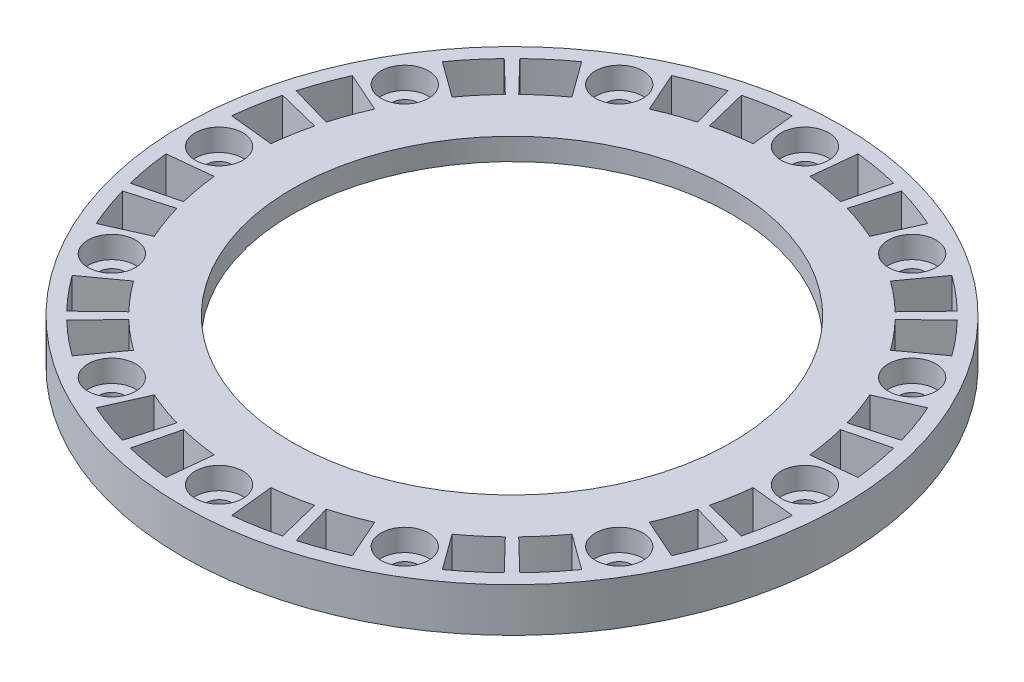
from build123d import *

# Parameters (mm, degrees)
SKETCH1_R           = 45
SKETCH1_R_2         = 30
SKETCH1_R_3         = 1.75
BOSS_EXTRUDE1_DEPTH = 6
SKETCH2_R           = 35.5
CUT_EXTRUDE1_DEPTH  = 3
SKETCH3_R           = 3.25
CUT_EXTRUDE2_DEPTH  = 3
CUT_EXTRUDE3_DEPTH  = 64.921827258


with BuildPart() as part:
    # Sketch1 → Boss-Extrude1 (new body)
    with BuildSketch(Plane(origin=(0, 0, 0), x_dir=(1, 0, 0), z_dir=(0, 1, 0))):
        Circle(SKETCH1_R)
        Circle(SKETCH1_R_2, mode=Mode.SUBTRACT)
        with Locations((0, 40)):
            Circle(SKETCH1_R_3, mode=Mode.SUBTRACT)
        with Locations((20, 34.641016151)):
            Circle(SKETCH1_R_3, mode=Mode.SUBTRACT)
        with Locations((34.641016151, 20)):
            Circle(SKETCH1_R_3, mode=Mode.SUBTRACT)
        with Locations((40, 0)):
            Circle(SKETCH1_R_3, mode=Mode.SUBTRACT)
        with Locations((34.641016151, -20)):
            Circle(SKETCH1_R_3, mode=Mode.SUBTRACT)
        with Locations((20, -34.641016151)):
            Circle(SKETCH1_R_3, mode=Mode.SUBTRACT)
        with Locations((0, -40)):
            Circle(SKETCH1_R_3, mode=Mode.SUBTRACT)
        with Locations((-20, -34.641016151)):
            Circle(SKETCH1_R_3, mode=Mode.SUBTRACT)
        with Locations((-34.641016151, -20)):
            Circle(SKETCH1_R_3, mode=Mode.SUBTRACT)
        with Locations((-40, 0)):
            Circle(SKETCH1_R_3, mode=Mode.SUBTRACT)
        with Locations((-34.641016151, 20)):
            Circle(SKETCH1_R_3, mode=Mode.SUBTRACT)
        with Locations((-20, 34.641016151)):
            Circle(SKETCH1_R_3, mode=Mode.SUBTRACT)
    extrude(amount=BOSS_EXTRUDE1_DEPTH)

    # Sketch2 → Cut-Extrude1 (cut)
    with BuildSketch(Plane.XZ):
        Circle(SKETCH2_R)
    extrude(amount=-CUT_EXTRUDE1_DEPTH, mode=Mode.SUBTRACT)

    # Sketch3 → Cut-Extrude2 (cut)
    with BuildSketch(Plane(origin=(0, 6, 0), x_dir=(1, 0, 0), z_dir=(0, 1, 0))):
        with Locations((40, 0)):
            Circle(SKETCH3_R)
        with Locations((34.641016151, -20)):
            Circle(SKETCH3_R)
        with Locations((20, -34.641016151)):
            Circle(SKETCH3_R)
        with Locations((0, -40)):
            Circle(SKETCH3_R)
        with Locations((-20, -34.641016151)):
            Circle(SKETCH3_R)
        with Locations((-34.641016151, -20)):
            Circle(SKETCH3_R)
        with Locations((-40, 0)):
            Circle(SKETCH3_R)
        with Locations((-34.641016151, 20)):
            Circle(SKETCH3_R)
        with Locations((-20, 34.641016151)):
            Circle(SKETCH3_R)
        with Locations((0, 40)):
            Circle(SKETCH3_R)
        with Locations((20, 34.641016151)):
            Circle(SKETCH3_R)
        with Locations((34.641016151, 20)):
            Circle(SKETCH3_R)
    extrude(amount=-CUT_EXTRUDE2_DEPTH, mode=Mode.SUBTRACT)

    # Sketch4 → Cut-Extrude3 (cut, through all)
    with BuildSketch(Plane.XZ):
        with BuildLine():
            Line((42.764441501, -4.494723921), (36.797310129, -3.867553141))
            ThreePointArc((36.797310129, -3.867553141), (36.437886861, -6.424982574), (35.900941872, -8.951110137))
            Line((35.900941872, -8.951110137), (41.72271623, -10.402641511))
            ThreePointArc((41.72271623, -10.402641511), (42.34673338, -7.46687164), (42.764441501, -4.494723921))
        make_face()
        with BuildLine():
            Line((39.282454679, -17.489675652), (33.801181933, -15.049255794))
            ThreePointArc((33.801181933, -15.049255794), (34.768626969, -12.654745303), (35.56668275, -10.198582165))
            Line((35.56668275, -10.198582165), (41.334252925, -11.8524063))
            ThreePointArc((41.334252925, -11.8524063), (40.406782694, -14.706866163), (39.282454679, -17.489675652))
        make_face()
        with BuildLine():
            Line((34.787730758, -25.274765849), (29.933628792, -21.748054335))
            ThreePointArc((29.933628792, -21.748054335), (28.343644395, -23.783141558), (26.615572613, -25.702359707))
            Line((26.615572613, -25.702359707), (30.931611415, -29.87030993))
            ThreePointArc((30.931611415, -29.87030993), (32.939911054, -27.639867217), (34.787730758, -25.274765849))
        make_face()
        with BuildLine():
            Line((29.87030993, -30.931611415), (25.702359707, -26.615572613))
            ThreePointArc((25.702359707, -26.615572613), (23.783141558, -28.343644395), (21.748054335, -29.933628792))
            Line((21.748054335, -29.933628792), (25.274765849, -34.787730758))
            ThreePointArc((25.274765849, -34.787730758), (27.639867217, -32.939911054), (29.87030993, -30.931611415))
        make_face()
        with BuildLine():
            Line((17.489675652, -39.282454679), (15.049255794, -33.801181933))
            ThreePointArc((15.049255794, -33.801181933), (12.654745303, -34.768626969), (10.198582165, -35.56668275))
            Line((10.198582165, -35.56668275), (11.8524063, -41.334252925))
            ThreePointArc((11.8524063, -41.334252925), (14.706866163, -40.406782694), (17.489675652, -39.282454679))
        make_face()
        with BuildLine():
            Line((10.402641511, -41.72271623), (8.951110137, -35.900941872))
            ThreePointArc((8.951110137, -35.900941872), (6.424982574, -36.437886861), (3.867553141, -36.797310129))
            Line((3.867553141, -36.797310129), (4.494723921, -42.764441501))
            ThreePointArc((4.494723921, -42.764441501), (7.46687164, -42.34673338), (10.402641511, -41.72271623))
        make_face()
        with BuildLine():
            Line((-4.494723921, -42.764441501), (-3.867553141, -36.797310129))
            ThreePointArc((-3.867553141, -36.797310129), (-6.424982574, -36.437886861), (-8.951110137, -35.900941872))
            Line((-8.951110137, -35.900941872), (-10.402641511, -41.72271623))
            ThreePointArc((-10.402641511, -41.72271623), (-7.46687164, -42.34673338), (-4.494723921, -42.764441501))
        make_face()
        with BuildLine():
            Line((-11.8524063, -41.334252925), (-10.198582165, -35.56668275))
            ThreePointArc((-10.198582165, -35.56668275), (-12.654745303, -34.768626969), (-15.049255794, -33.801181933))
            Line((-15.049255794, -33.801181933), (-17.489675652, -39.282454679))
            ThreePointArc((-17.489675652, -39.282454679), (-14.706866163, -40.406782694), (-11.8524063, -41.334252925))
        make_face()
        with BuildLine():
            Line((-25.274765849, -34.787730758), (-21.748054335, -29.933628792))
            ThreePointArc((-21.748054335, -29.933628792), (-23.783141558, -28.343644395), (-25.702359707, -26.615572613))
            Line((-25.702359707, -26.615572613), (-29.87030993, -30.931611415))
            ThreePointArc((-29.87030993, -30.931611415), (-27.639867217, -32.939911054), (-25.274765849, -34.787730758))
        make_face()
        with BuildLine():
            Line((-30.931611415, -29.87030993), (-26.615572613, -25.702359707))
            ThreePointArc((-26.615572613, -25.702359707), (-28.343644395, -23.783141558), (-29.933628792, -21.748054335))
            Line((-29.933628792, -21.748054335), (-34.787730758, -25.274765849))
            ThreePointArc((-34.787730758, -25.274765849), (-32.939911054, -27.639867217), (-30.931611415, -29.87030993))
        make_face()
        with BuildLine():
            Line((-39.282454679, -17.489675652), (-33.801181933, -15.049255794))
            ThreePointArc((-33.801181933, -15.049255794), (-34.768626969, -12.654745303), (-35.56668275, -10.198582165))
            Line((-35.56668275, -10.198582165), (-41.334252925, -11.8524063))
            ThreePointArc((-41.334252925, -11.8524063), (-40.406782694, -14.706866163), (-39.282454679, -17.489675652))
        make_face()
        with BuildLine():
            Line((-41.72271623, -10.402641511), (-35.900941872, -8.951110137))
            ThreePointArc((-35.900941872, -8.951110137), (-36.437886861, -6.424982574), (-36.797310129, -3.867553141))
            Line((-36.797310129, -3.867553141), (-42.764441501, -4.494723921))
            ThreePointArc((-42.764441501, -4.494723921), (-42.34673338, -7.46687164), (-41.72271623, -10.402641511))
        make_face()
        with BuildLine():
            Line((-42.764441501, 4.494723921), (-36.797310129, 3.867553141))
            ThreePointArc((-36.797310129, 3.867553141), (-36.437886861, 6.424982574), (-35.900941872, 8.951110137))
            Line((-35.900941872, 8.951110137), (-41.72271623, 10.402641511))
            ThreePointArc((-41.72271623, 10.402641511), (-42.34673338, 7.46687164), (-42.764441501, 4.494723921))
        make_face()
        with BuildLine():
            Line((-41.334252925, 11.8524063), (-35.56668275, 10.198582165))
            ThreePointArc((-35.56668275, 10.198582165), (-34.768626969, 12.654745303), (-33.801181933, 15.049255794))
            Line((-33.801181933, 15.049255794), (-39.282454679, 17.489675652))
            ThreePointArc((-39.282454679, 17.489675652), (-40.406782694, 14.706866163), (-41.334252925, 11.8524063))
        make_face()
        with BuildLine():
            Line((-34.787730758, 25.274765849), (-29.933628792, 21.748054335))
            ThreePointArc((-29.933628792, 21.748054335), (-28.343644395, 23.783141558), (-26.615572613, 25.702359707))
            Line((-26.615572613, 25.702359707), (-30.931611415, 29.87030993))
            ThreePointArc((-30.931611415, 29.87030993), (-32.939911054, 27.639867217), (-34.787730758, 25.274765849))
        make_face()
        with BuildLine():
            Line((-29.87030993, 30.931611415), (-25.702359707, 26.615572613))
            ThreePointArc((-25.702359707, 26.615572613), (-23.783141558, 28.343644395), (-21.748054335, 29.933628792))
            Line((-21.748054335, 29.933628792), (-25.274765849, 34.787730758))
            ThreePointArc((-25.274765849, 34.787730758), (-27.639867217, 32.939911054), (-29.87030993, 30.931611415))
        make_face()
        with BuildLine():
            Line((-17.489675652, 39.282454679), (-15.049255794, 33.801181933))
            ThreePointArc((-15.049255794, 33.801181933), (-12.654745303, 34.768626969), (-10.198582165, 35.56668275))
            Line((-10.198582165, 35.56668275), (-11.8524063, 41.334252925))
            ThreePointArc((-11.8524063, 41.334252925), (-14.706866163, 40.406782694), (-17.489675652, 39.282454679))
        make_face()
        with BuildLine():
            Line((-10.402641511, 41.72271623), (-8.951110137, 35.900941872))
            ThreePointArc((-8.951110137, 35.900941872), (-6.424982574, 36.437886861), (-3.867553141, 36.797310129))
            Line((-3.867553141, 36.797310129), (-4.494723921, 42.764441501))
            ThreePointArc((-4.494723921, 42.764441501), (-7.46687164, 42.34673338), (-10.402641511, 41.72271623))
        make_face()
        with BuildLine():
            Line((4.494723921, 42.764441501), (3.867553141, 36.797310129))
            ThreePointArc((3.867553141, 36.797310129), (6.424982574, 36.437886861), (8.951110137, 35.900941872))
            Line((8.951110137, 35.900941872), (10.402641511, 41.72271623))
            ThreePointArc((10.402641511, 41.72271623), (7.46687164, 42.34673338), (4.494723921, 42.764441501))
        make_face()
        with BuildLine():
            Line((11.8524063, 41.334252925), (10.198582165, 35.56668275))
            ThreePointArc((10.198582165, 35.56668275), (12.654745303, 34.768626969), (15.049255794, 33.801181933))
            Line((15.049255794, 33.801181933), (17.489675652, 39.282454679))
            ThreePointArc((17.489675652, 39.282454679), (14.706866163, 40.406782694), (11.8524063, 41.334252925))
        make_face()
        with BuildLine():
            Line((25.274765849, 34.787730758), (21.748054335, 29.933628792))
            ThreePointArc((21.748054335, 29.933628792), (23.783141558, 28.343644395), (25.702359707, 26.615572613))
            Line((25.702359707, 26.615572613), (29.87030993, 30.931611415))
            ThreePointArc((29.87030993, 30.931611415), (27.639867217, 32.939911054), (25.274765849, 34.787730758))
        make_face()
        with BuildLine():
            Line((30.931611415, 29.87030993), (26.615572613, 25.702359707))
            ThreePointArc((26.615572613, 25.702359707), (28.343644395, 23.783141558), (29.933628792, 21.748054335))
            Line((29.933628792, 21.748054335), (34.787730758, 25.274765849))
            ThreePointArc((34.787730758, 25.274765849), (32.939911054, 27.639867217), (30.931611415, 29.87030993))
        make_face()
        with BuildLine():
            Line((39.282454679, 17.489675652), (33.801181933, 15.049255794))
            ThreePointArc((33.801181933, 15.049255794), (34.768626969, 12.654745303), (35.56668275, 10.198582165))
            Line((35.56668275, 10.198582165), (41.334252925, 11.8524063))
            ThreePointArc((41.334252925, 11.8524063), (40.406782694, 14.706866163), (39.282454679, 17.489675652))
        make_face()
        with BuildLine():
            Line((41.72271623, 10.402641511), (35.900941872, 8.951110137))
            ThreePointArc((35.900941872, 8.951110137), (36.437886861, 6.424982574), (36.797310129, 3.867553141))
            Line((36.797310129, 3.867553141), (42.764441501, 4.494723921))
            ThreePointArc((42.764441501, 4.494723921), (42.34673338, 7.46687164), (41.72271623, 10.402641511))
        make_face()
    extrude(amount=-CUT_EXTRUDE3_DEPTH, mode=Mode.SUBTRACT)


solid = part.part
